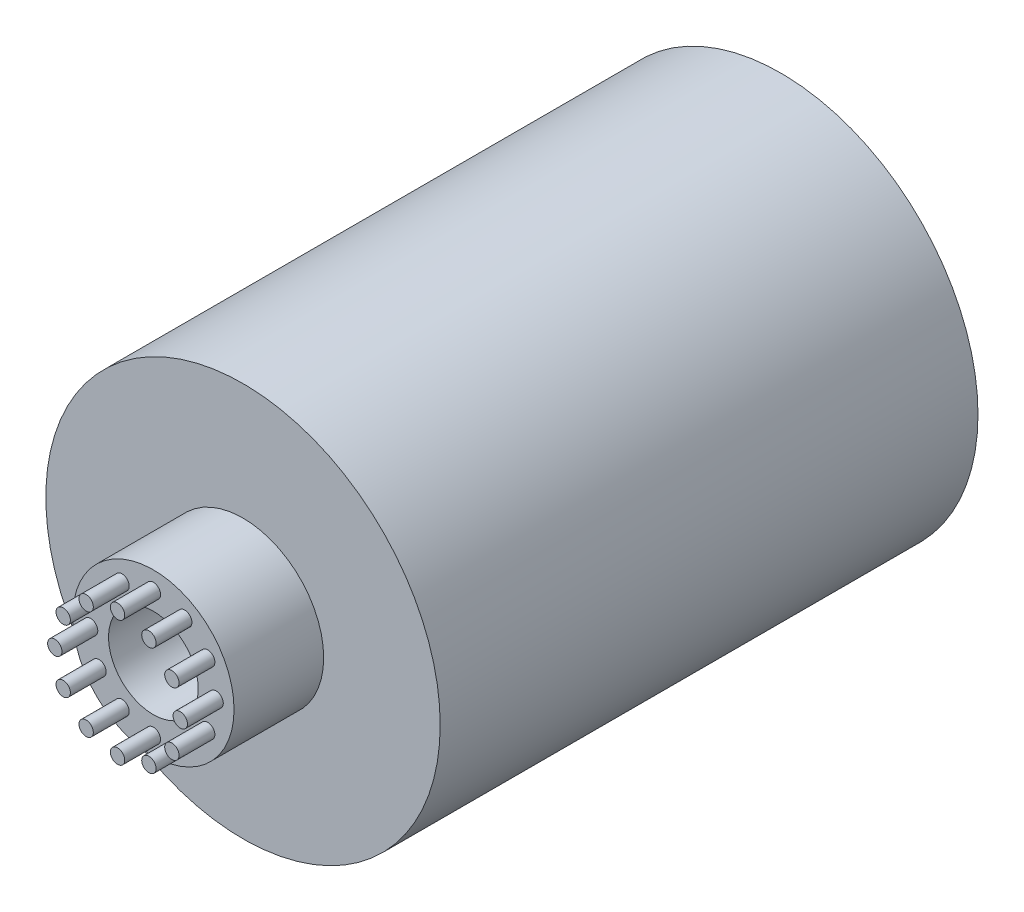
from build123d import *

# Parameters (mm, degrees)
SKETCH2_R           = 11
BOSS_EXTRUDE1_DEPTH = 30
SKETCH3_R           = 4.5
BOSS_EXTRUDE2_DEPTH = 5
BOSS_EXTRUDE3_START = 4
SKETCH4_R           = 4.5
BOSS_EXTRUDE3_DEPTH = 4
SKETCH5_R           = 2.5
CUT_EXTRUDE1_DEPTH  = 42.98809355
SKETCH6_R           = 0.4
BOSS_EXTRUDE4_DEPTH = 2
CIRPATTERN1_COUNT   = 12


with BuildPart() as part:
    # Sketch2 → Boss-Extrude1 (new body)
    with BuildSketch(Plane.XY):
        Circle(SKETCH2_R)
    extrude(amount=BOSS_EXTRUDE1_DEPTH)

    # Sketch3 → Boss-Extrude2 (add)
    with BuildSketch(Plane.XY.offset(30)):
        Circle(SKETCH3_R)
    extrude(amount=BOSS_EXTRUDE2_DEPTH)

    # Sketch4 → Boss-Extrude3 (add)
    with BuildSketch(Plane(origin=(0, 0, 0), x_dir=(-1, 0, 0), z_dir=(0, 0, -1)).offset(BOSS_EXTRUDE3_START)):
        Circle(SKETCH4_R)
    extrude(amount=-BOSS_EXTRUDE3_DEPTH)

    # Sketch5 → Cut-Extrude1 (cut, through all)
    with BuildSketch(Plane.XY.offset(35)):
        Circle(SKETCH5_R)
    extrude(amount=-CUT_EXTRUDE1_DEPTH, mode=Mode.SUBTRACT)

    # Sketch6 → Boss-Extrude4 (add)
    with BuildSketch(Plane.XY.offset(35)):
        with Locations((0, 3.5)):
            Circle(SKETCH6_R)
    boss_extrude4 = extrude(amount=BOSS_EXTRUDE4_DEPTH)

    # CirPattern1: Boss-Extrude4 ×12 about axis
    cirpattern1_axis = Axis((0, 0, 35), (0, 0, 1))
    for i in range(1, CIRPATTERN1_COUNT):
        add(boss_extrude4.rotate(cirpattern1_axis, i * 360 / CIRPATTERN1_COUNT))


solid = part.part
